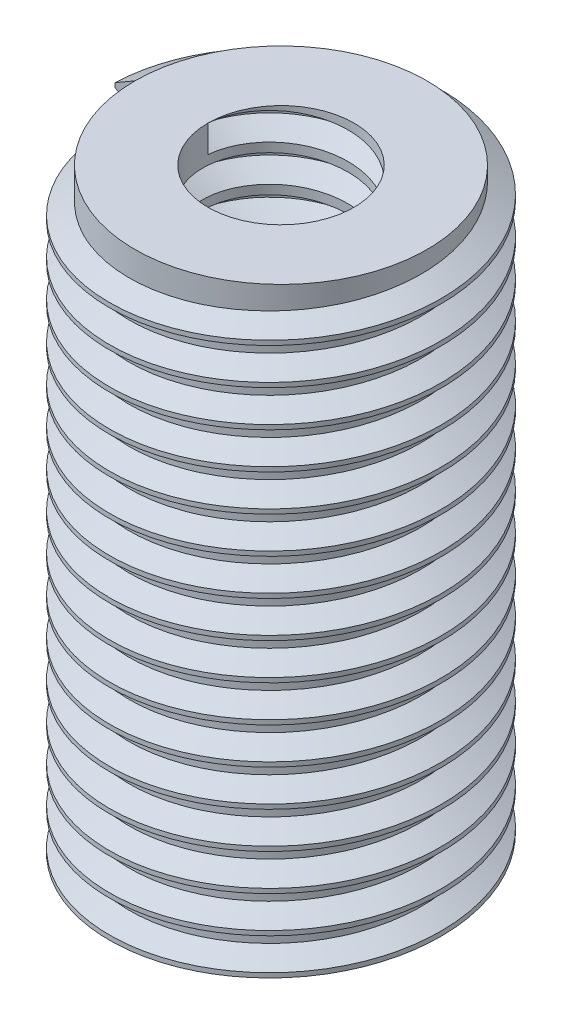
from build123d import *
from build123d.topology import SkipClean

# Parameters (mm, degrees)
SKETCH1_R           = 5
BOSS_EXTRUDE1_DEPTH = 20
SKETCH2_R           = 2.5
CUT_EXTRUDE1_DEPTH  = 22.213203436
THREAD1_PITCH       = 1.25
THREAD2_PITCH       = 1.25


with BuildPart() as part:
    # Sketch1 → Boss-Extrude1 (new body)
    with BuildSketch(Plane(origin=(0, 0, 0), x_dir=(1, 0, 0), z_dir=(0, 1, 0))):
        with Locations(Location((0, 0, 0), (0, 0, 270))):
            Circle(SKETCH1_R)
    extrude(amount=BOSS_EXTRUDE1_DEPTH)

    # Sketch2 → Cut-Extrude1 (cut, through all)
    with BuildSketch(Plane(origin=(0, 20, 0), x_dir=(1, 0, 0), z_dir=(0, 1, 0))):
        with Locations(Location((0, 0, 0), (0, 0, 270))):
            Circle(SKETCH2_R)
    extrude(amount=-CUT_EXTRUDE1_DEPTH, mode=Mode.SUBTRACT)

    # Thread1: the profile of Thread Profile1 profile screwed along a right-hand helix of 16 turns, 8 arcs to a turn; built about Z, then put on its axis
    thread1_z = Axis((0, 0, 0), (0, 0, 1))
    thread1_corners = [(2.4997, 0, -0.000173205), (3.176582344, 0, 0.390624998), (3.176582344, 0, 0.546874998), (2.4997, 0, 0.937673202)]
    with BuildLine(mode=Mode.PRIVATE) as thread1_profile:
        Line(thread1_corners[0], thread1_corners[1])
        Line(thread1_corners[1], thread1_corners[2])
        Line(thread1_corners[2], thread1_corners[3])
        Line(thread1_corners[3], thread1_corners[0])
    thread1_cap = Face(thread1_profile.wire())
    thread1_turn_angles = [0, 22.5, 45, 67.5, 90, 112.5, 135, 157.5, 180, 202.5, 225, 247.5, 270, 292.5, 315, 337.5, 360]
    thread1_turn_weights = [1, 0.9238795325112867, 1, 0.9238795325112867, 1, 0.9238795325112867, 1, 0.9238795325112867, 1, 0.9238795325112867, 1, 0.9238795325112867, 1, 0.9238795325112867, 1, 0.9238795325112867, 1]
    thread1_turn_rails = [Edge.make_bspline([Vector(p[0], p[1], 0).rotate(thread1_z, thread1_turn_angles[k]) / thread1_turn_weights[k] + Vector(0, 0, p[2] + THREAD1_PITCH * thread1_turn_angles[k] / 360) for k in range(17)], [0, 0, 0, 1, 1, 2, 2, 3, 3, 4, 4, 5, 5, 6, 6, 7, 7, 8, 8, 8], 2, thread1_turn_weights) for p in thread1_corners]
    thread1_turn_sides = [Face.make_surface_from_curves(thread1_turn_rails[p[0]], thread1_turn_rails[p[1]]) for p in [(0, 1), (1, 2), (2, 3), (3, 0)]]
    thread1 = Plane(origin=(0, 20, 0), x_dir=(-1, 0, 0), z_dir=(0, -1, 0)) * Solid(Shell([*[p.moved(Location((0, 0, THREAD1_PITCH * i))) for i in range(16) for p in thread1_turn_sides], thread1_cap, thread1_cap.rotate(thread1_z, 5760).moved(Location((0, 0, THREAD1_PITCH * 5760 / 360)))]))
    add(thread1, mode=Mode.SUBTRACT)

    # Thread2: the profile of Thread Profile2 profile screwed along a right-hand helix of 16 turns, 8 arcs to a turn; built about Z, then put on its axis
    with SkipClean():  # the faces are left unmerged after this step: merging them gives an invalid solid
        thread2_z = Axis((0, 0, 0), (0, 0, 1))
        thread2_corners = [(4.9997, 0, -0.000173205), (5.676582344, 0, 0.390624998), (5.676582344, 0, 0.546874998), (4.9997, 0, 0.937673202)]
        with BuildLine(mode=Mode.PRIVATE) as thread2_profile:
            Line(thread2_corners[0], thread2_corners[1])
            Line(thread2_corners[1], thread2_corners[2])
            Line(thread2_corners[2], thread2_corners[3])
            Line(thread2_corners[3], thread2_corners[0])
        thread2_cap = Face(thread2_profile.wire())
        thread2_turn_angles = [0, 22.5, 45, 67.5, 90, 112.5, 135, 157.5, 180, 202.5, 225, 247.5, 270, 292.5, 315, 337.5, 360]
        thread2_turn_weights = [1, 0.9238795325112867, 1, 0.9238795325112867, 1, 0.9238795325112867, 1, 0.9238795325112867, 1, 0.9238795325112867, 1, 0.9238795325112867, 1, 0.9238795325112867, 1, 0.9238795325112867, 1]
        thread2_turn_rails = [Edge.make_bspline([Vector(p[0], p[1], 0).rotate(thread2_z, thread2_turn_angles[k]) / thread2_turn_weights[k] + Vector(0, 0, p[2] + THREAD2_PITCH * thread2_turn_angles[k] / 360) for k in range(17)], [0, 0, 0, 1, 1, 2, 2, 3, 3, 4, 4, 5, 5, 6, 6, 7, 7, 8, 8, 8], 2, thread2_turn_weights) for p in thread2_corners]
        thread2_turn_sides = [Face.make_surface_from_curves(thread2_turn_rails[p[0]], thread2_turn_rails[p[1]]) for p in [(0, 1), (1, 2), (2, 3), (3, 0)]]
        thread2 = Plane(origin=(0, 20, 0), x_dir=(-1, 0, 0), z_dir=(0, -1, 0)) * Solid(Shell([*[p.moved(Location((0, 0, THREAD2_PITCH * i))) for i in range(16) for p in thread2_turn_sides], thread2_cap, thread2_cap.rotate(thread2_z, 5760).moved(Location((0, 0, THREAD2_PITCH * 5760 / 360)))]))
        add(thread2)


solid = part.part
